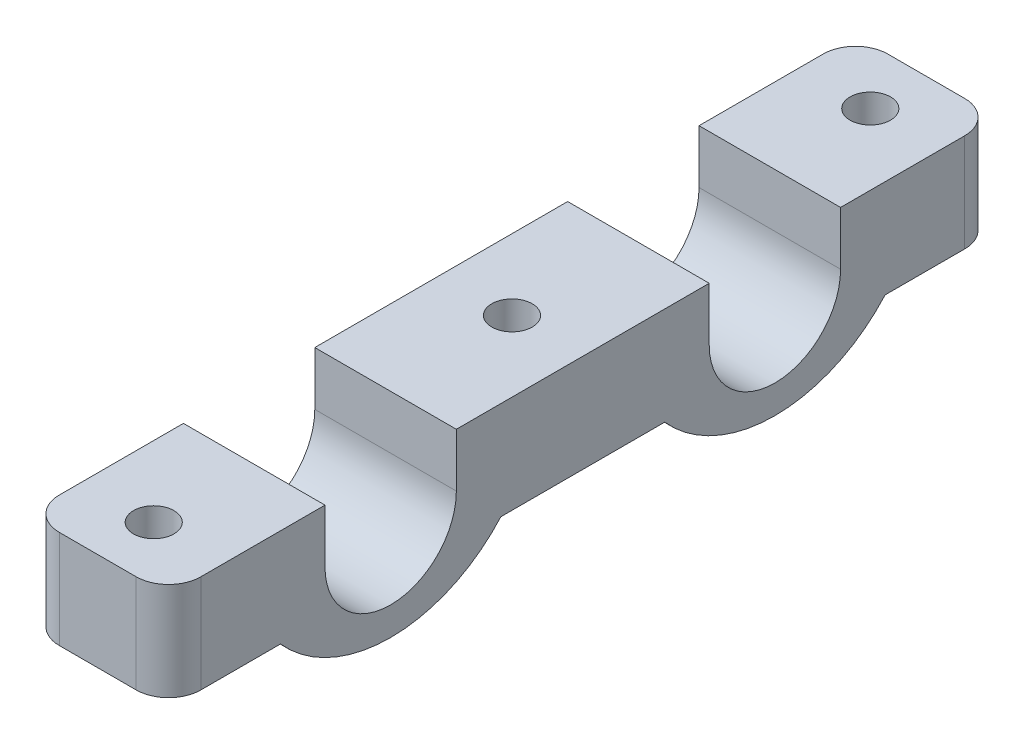
from build123d import *

# Parameters (mm, degrees)
BOSS_EXTRUDE1_DEPTH = 35
CUT_EXTRUDE1_REACH  = 160.215
SKETCH3_R           = 5
SKETCH4_R           = 10.5
CUT_EXTRUDE2_DEPTH  = 10
FILLET1_R           = 8


with BuildPart() as part:
    # Sketch2 → Boss-Extrude1 (new body)
    with BuildSketch(Plane(origin=(0, 0, 0), x_dir=(0, 0, -1), z_dir=(1, 0, 0))):
        with BuildLine():
            Line((-27.24, -11), (-54.920224718, -11))
            Line((-54.920224718, -11), (-54.920224718, 0))
            Line((-54.920224718, 0), (-54.920224718, 13.24))
            Line((-54.920224718, 13.24), (-16.24, 13.24))
            Line((-16.24, 13.24), (-16.24, 0))
            ThreePointArc((-16.24, 0), (0, -16.24), (16.24, 0))
            Line((16.24, 0), (16.24, 13.24))
            Line((16.24, 13.24), (78.76, 13.24))
            Line((78.76, 13.24), (78.76, 0))
            ThreePointArc((78.76, 0), (95, -16.24), (111.24, 0))
            Line((111.24, 0), (111.24, 13.24))
            Line((111.24, 13.24), (149.920224718, 13.24))
            Line((149.920224718, 13.24), (149.920224718, 0))
            Line((149.920224718, 0), (149.920224718, -11))
            Line((149.920224718, -11), (122.24, -11))
            ThreePointArc((122.24, -11), (95, -23.24), (67.76, -11))
            Line((67.76, -11), (27.24, -11))
            ThreePointArc((27.24, -11), (0, -23.24), (-27.24, -11))
        make_face()
    extrude(amount=BOSS_EXTRUDE1_DEPTH)

    # Sketch3 → Cut-Extrude1 (cut, up to next)
    with BuildSketch(Plane(origin=(0, 13.24, 0), x_dir=(1, 0, 0), z_dir=(0, 1, 0)), mode=Mode.PRIVATE) as cut_extrude1_sk1:
        with Locations((17.5, -41.080112359)):
            Circle(SKETCH3_R)
    cut_extrude1_tool1 = extrude(cut_extrude1_sk1.sketch, amount=-CUT_EXTRUDE1_REACH, mode=Mode.PRIVATE) & part.part
    # Sketch3 → Cut-Extrude1 (cut, up to next)
    with BuildSketch(Plane(origin=(0, 13.24, 0), x_dir=(1, 0, 0), z_dir=(0, 1, 0)), mode=Mode.PRIVATE) as cut_extrude1_sk2:
        with Locations((17.5, 136.080112359)):
            Circle(SKETCH3_R)
    cut_extrude1_tool2 = extrude(cut_extrude1_sk2.sketch, amount=-CUT_EXTRUDE1_REACH, mode=Mode.PRIVATE) & part.part
    # Sketch3 → Cut-Extrude1 (cut, up to next)
    with BuildSketch(Plane(origin=(0, 13.24, 0), x_dir=(1, 0, 0), z_dir=(0, 1, 0)), mode=Mode.PRIVATE) as cut_extrude1_sk3:
        with Locations((17.5, 47.5)):
            Circle(SKETCH3_R)
    cut_extrude1_tool3 = extrude(cut_extrude1_sk3.sketch, amount=-CUT_EXTRUDE1_REACH, mode=Mode.PRIVATE) & part.part
    add(cut_extrude1_tool1.solids().sort_by_distance((17.5, 13.24, 41.080112))[0], mode=Mode.SUBTRACT)
    add(cut_extrude1_tool2.solids().sort_by_distance((17.5, 13.24, -136.080112))[0], mode=Mode.SUBTRACT)
    add(cut_extrude1_tool3.solids().sort_by_distance((17.5, 13.24, -47.5))[0], mode=Mode.SUBTRACT)

    # Sketch4 → Cut-Extrude2 (cut)
    with BuildSketch(Plane.XZ.offset(11)):
        with Locations((17.5, -47.5)):
            Circle(SKETCH4_R)
        with Locations((17.5, -136.080112359)):
            Circle(SKETCH4_R)
        with Locations((17.5, 41.080112359)):
            Circle(SKETCH4_R)
    extrude(amount=-CUT_EXTRUDE2_DEPTH, mode=Mode.SUBTRACT)

    # Fillet1
    fillet1_edges = [part.edges().sort_by_distance(p)[0] for p in [
        (35, 1.12, 54.920224718),
        (0, 1.12, 54.920224718),
        (35, 1.12, -149.920224718),
        (0, 1.12, -149.920224718),
    ]]
    fillet(fillet1_edges, radius=FILLET1_R)


solid = part.part
